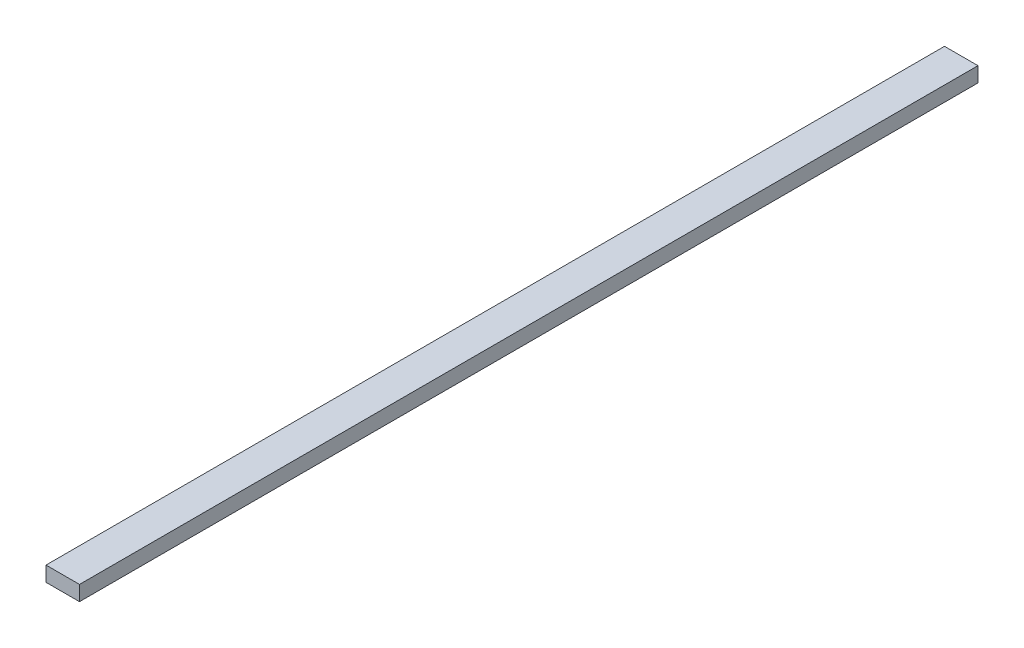
from build123d import *

# Parameters (mm, degrees)
SKETCH1_W           = 16.6624
SKETCH1_H           = 37.2872
BOSS_EXTRUDE1_DEPTH = 500


with BuildPart() as part:
    # Sketch1 → Boss-Extrude1 (new, symmetric)
    with BuildSketch(Plane(origin=(0, 0, 0), x_dir=(0, 1, 0), z_dir=(0, 0, 1))):
        Rectangle(SKETCH1_W, SKETCH1_H)
    extrude(amount=BOSS_EXTRUDE1_DEPTH, both=True)


solid = part.part
